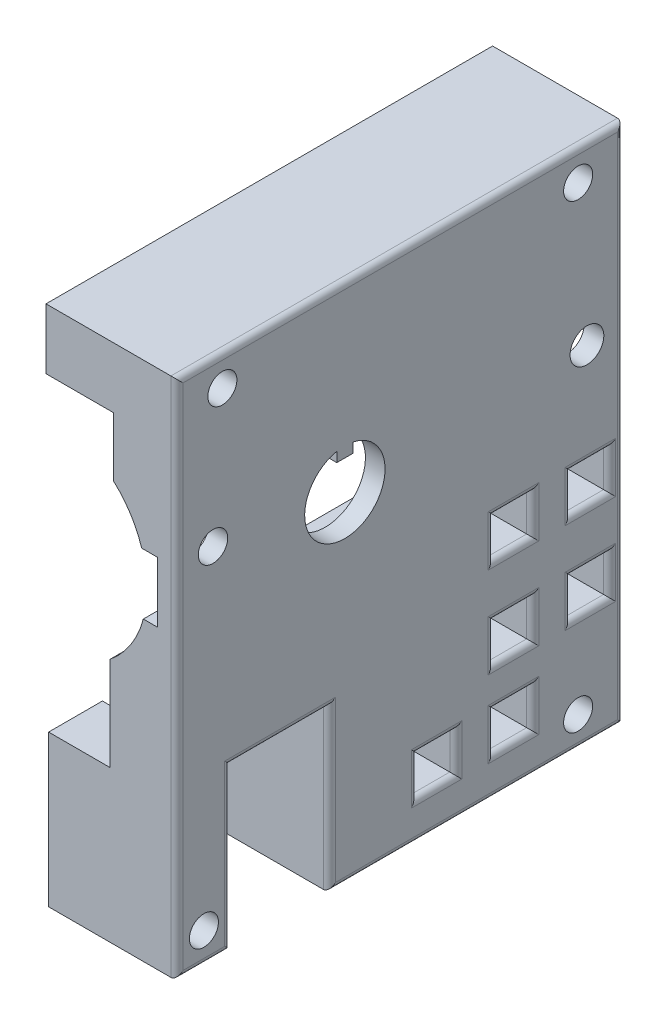
from build123d import *

# Parameters (mm, degrees)
PROFILEEXTRUDE_DEPTH = 73.76
HOSEWINDOW_W         = 16.29
HOSEWINDOW_H         = 26.5
HOSEWINDOWCUT_DEPTH  = 97.672784203
CAGESCREWS_R         = 2.4
CAGESCREWSCUT_DEPTH  = 97.672784203
AXLEHOLECUT_DEPTH    = 97.672784203
SETSCREWS_R          = 2.426338021
SETSCREWS_R_2        = 2.788762315
SETSCREWSCUT_DEPTH   = 97.67278428
SKETCH1_W            = 6.35
SKETCH1_H            = 6.35
CUT_EXTRUDE1_DEPTH   = 97.67278428
FILLET1_R            = 1


with BuildPart() as part:
    # Profile → ProfileExtrude (new body)
    with BuildSketch(Plane.XY):
        with BuildLine():
            Line((-6.01073477, -58.62791746), (-6.01073477, -33.62791746))
            Line((-6.01073477, -33.62791746), (4.13926523, -33.62791746))
            Line((4.13926523, -33.62791746), (4.13926523, -18.13791746))
            ThreePointArc((4.13926523, -18.13791746), (7.563334043, -14.326029686), (9.63126523, -9.63791746))
            Line((9.63126523, -9.63791746), (11.94926523, -9.63791746))
            Line((11.94926523, -9.63791746), (11.94926523, 0.36208254))
            Line((11.94926523, 0.36208254), (9.35926523, 0.36208254))
            ThreePointArc((9.35926523, 0.36208254), (7.525939238, 4.313848402), (4.70926523, 7.63708254))
            Line((4.70926523, 7.63708254), (4.70926523, 17.41208254))
            Line((4.70926523, 17.41208254), (-6.44073477, 17.41208254))
            Line((-6.44073477, 17.41208254), (-6.44073477, 27.41208254))
            Line((-6.44073477, 27.41208254), (15.18926523, 27.41208254))
            Line((15.18926523, 27.41208254), (15.18926523, -58.62791746))
            Line((15.18926523, -58.62791746), (-6.01073477, -58.62791746))
        make_face()
    extrude(amount=PROFILEEXTRUDE_DEPTH)

    # HoseWindow → HoseWindowCut (cut, through all)
    with BuildSketch(Plane(origin=(15.18926523, 0, 0), x_dir=(0, 0, -1), z_dir=(1, 0, 0))):
        with Locations((-56.725, -45.37791746)):
            Rectangle(HOSEWINDOW_W, HOSEWINDOW_H)
    extrude(amount=-HOSEWINDOWCUT_DEPTH, mode=Mode.SUBTRACT)

    # CageScrews → CageScrewsCut (cut, through all)
    with BuildSketch(Plane(origin=(15.18926523, 0, 0), x_dir=(0, 0, -1), z_dir=(1, 0, 0))):
        with Locations((-66.26, 22.41208254)):
            Circle(CAGESCREWS_R)
        with Locations((-7.5, 22.41208254)):
            Circle(CAGESCREWS_R)
        with Locations((-7.5, -53.62791746)):
            Circle(CAGESCREWS_R)
        with Locations((-69.31, -53.62791746)):
            Circle(CAGESCREWS_R)
    extrude(amount=-CAGESCREWSCUT_DEPTH, mode=Mode.SUBTRACT)

    # AxleHole → AxleHoleCut (cut, through all)
    with BuildSketch(Plane(origin=(15.18926523, 0, 0), x_dir=(0, 0, -1), z_dir=(1, 0, 0))):
        with BuildLine():
            Line((-44.699, 2.307293484), (-47.361, 2.307293484))
            Line((-47.361, 2.307293484), (-47.361, 3.926293484))
            ThreePointArc((-47.361, 3.926293484), (-46.03, -9.21691746), (-44.699, 3.926293484))
            Line((-44.699, 3.926293484), (-44.699, 2.307293484))
        make_face()
    extrude(amount=-AXLEHOLECUT_DEPTH, mode=Mode.SUBTRACT)

    # SetScrews → SetScrewsCut (cut, through all)
    with BuildSketch(Plane(origin=(15.18926523, 0, 0), x_dir=(0, 0, -1), z_dir=(1, 0, 0))):
        with Locations((-67.80722939, 0.544946624)):
            Circle(SETSCREWS_R)
        with Locations((-6.04299884, -1.55824191)):
            Circle(SETSCREWS_R_2)
    extrude(amount=-SETSCREWSCUT_DEPTH, mode=Mode.SUBTRACT)

    # Sketch1 → Cut-Extrude1 (cut, through all)
    with BuildSketch(Plane(origin=(15.18926523, 0, 0), x_dir=(0, 0, -1), z_dir=(1, 0, 0))):
        with Locations((-18.175, -49.10291746)):
            Rectangle(SKETCH1_W, SKETCH1_H)
        with Locations((-30.875, -49.10291746)):
            Rectangle(SKETCH1_W, SKETCH1_H)
        with Locations((-5.475, -36.40291746)):
            Rectangle(SKETCH1_W, SKETCH1_H)
        with Locations((-18.175, -36.40291746)):
            Rectangle(SKETCH1_W, SKETCH1_H)
        with Locations((-5.475, -21.40291746)):
            Rectangle(SKETCH1_W, SKETCH1_H)
        with Locations((-18.175, -21.40291746)):
            Rectangle(SKETCH1_W, SKETCH1_H)
    extrude(amount=-CUT_EXTRUDE1_DEPTH, mode=Mode.SUBTRACT)

    # Fillet1
    fillet1_edges = [part.edges().sort_by_distance(p)[0] for p in [
        (15.18926523, -52.27791746, 30.875),
        (15.18926523, -49.10291746, 34.05),
        (15.18926523, -45.92791746, 30.875),
        (15.18926523, -49.10291746, 27.7),
        (15.18926523, -49.10291746, 21.35),
        (15.18926523, -52.27791746, 18.175),
        (15.18926523, -49.10291746, 15),
        (15.18926523, -45.92791746, 18.175),
        (15.18926523, -36.40291746, 8.65),
        (15.18926523, -39.57791746, 5.475),
        (15.18926523, -36.40291746, 2.3),
        (15.18926523, -33.22791746, 5.475),
        (15.18926523, -36.40291746, 21.35),
        (15.18926523, -39.57791746, 18.175),
        (15.18926523, -36.40291746, 15),
        (15.18926523, -33.22791746, 18.175),
        (15.18926523, -21.40291746, 21.35),
        (15.18926523, -24.57791746, 18.175),
        (15.18926523, -21.40291746, 15),
        (15.18926523, -18.22791746, 18.175),
        (15.18926523, -21.40291746, 8.65),
        (15.18926523, -24.57791746, 5.475),
        (15.18926523, -21.40291746, 2.3),
        (15.18926523, -18.22791746, 5.475),
        (15.18926523, -58.62791746, 69.315),
        (15.18926523, -45.37791746, 64.87),
        (15.18926523, -32.12791746, 56.725),
        (15.18926523, -45.37791746, 48.58),
        (15.18926523, -58.62791746, 24.29),
        (15.18926523, -15.60791746, 0),
        (15.18926523, 27.41208254, 36.88),
        (15.18926523, -15.60791746, 73.76),
    ]]
    fillet(fillet1_edges, radius=FILLET1_R)


solid = part.part
